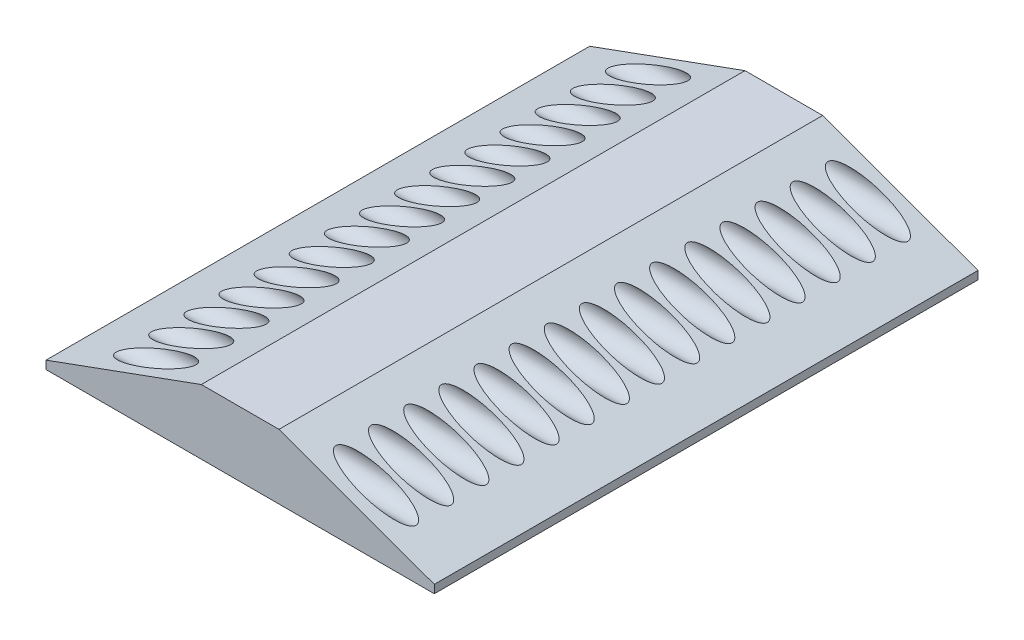
from build123d import *

# Parameters (mm, degrees)
SKETCH1_W           = 30
SKETCH1_H           = 42
BOSS_EXTRUDE1_DEPTH = 5
SKETCH2_R           = 1.125
CUT_EXTRUDE1_DEPTH  = 37.959437225
CHAMFER1_SIZE       = 4.367642811
CHAMFER1_SIZE_2     = 12
CHAMFER2_SIZE       = 12
CHAMFER2_SIZE_2     = 4.367642811


with BuildPart() as part:
    # Sketch1 → Boss-Extrude1 (new body)
    with BuildSketch(Plane(origin=(0, 0, 0), x_dir=(1, 0, 0), z_dir=(0, 1, 0))):
        Rectangle(SKETCH1_W, SKETCH1_H)
    extrude(amount=BOSS_EXTRUDE1_DEPTH)

    # Sketch2 → Cut-Extrude1 (cut, through all)
    with BuildSketch(Plane(origin=(15, 0, 0), x_dir=(0, 0, -1), z_dir=(1, 0, 0))):
        with Locations((-19, 3)):
            Circle(SKETCH2_R)
        with Locations((-16.285714286, 3)):
            Circle(SKETCH2_R)
        with Locations((-13.571428571, 3)):
            Circle(SKETCH2_R)
        with Locations((-10.857142857, 3)):
            Circle(SKETCH2_R)
        with Locations((-8.142857143, 3)):
            Circle(SKETCH2_R)
        with Locations((-5.428571429, 3)):
            Circle(SKETCH2_R)
        with Locations((-2.714285714, 3)):
            Circle(SKETCH2_R)
        with Locations((0, 3)):
            Circle(SKETCH2_R)
        with Locations((2.714285714, 3)):
            Circle(SKETCH2_R)
        with Locations((5.428571429, 3)):
            Circle(SKETCH2_R)
        with Locations((8.142857143, 3)):
            Circle(SKETCH2_R)
        with Locations((10.857142857, 3)):
            Circle(SKETCH2_R)
        with Locations((13.571428571, 3)):
            Circle(SKETCH2_R)
        with Locations((16.285714286, 3)):
            Circle(SKETCH2_R)
        with Locations((19, 3)):
            Circle(SKETCH2_R)
    extrude(amount=-CUT_EXTRUDE1_DEPTH, mode=Mode.SUBTRACT)

    # Chamfer1
    # the kernel refuses this chamfer: 12, 4.367642811 mm, written as the material it takes off along each edge
    with BuildSketch(Plane(origin=(15, 5, 52.130336791), x_dir=(0.09904090225204926, -0.9950833631817486, 0), z_dir=(0, 0, -1))) as chamfer1_piece_1:
        Polygon((CHAMFER1_SIZE * 0.995083363226, CHAMFER1_SIZE * 0.0990409022565), (-CHAMFER1_SIZE_2 * 0.099040902252, CHAMFER1_SIZE_2 * 0.995083363182), (0, 0), align=None)
    extrude(amount=104.260673581, mode=Mode.SUBTRACT)

    # Chamfer2
    # the kernel refuses this chamfer: 12, 4.367642811 mm, written as the material it takes off along each edge
    with BuildSketch(Plane(origin=(-15, 5, -52.130336791), x_dir=(0.9999130865277315, 0.013184058198645937, 0), z_dir=(0, 0, 1))) as chamfer2_piece_1:
        Polygon((CHAMFER2_SIZE * 0.999913086528, -CHAMFER2_SIZE * 0.0131840581986), (-CHAMFER2_SIZE_2 * 0.0131840581992, -CHAMFER2_SIZE_2 * 0.999913086572), (0, 0), align=None)
    extrude(amount=104.260673581, mode=Mode.SUBTRACT)


solid = part.part
